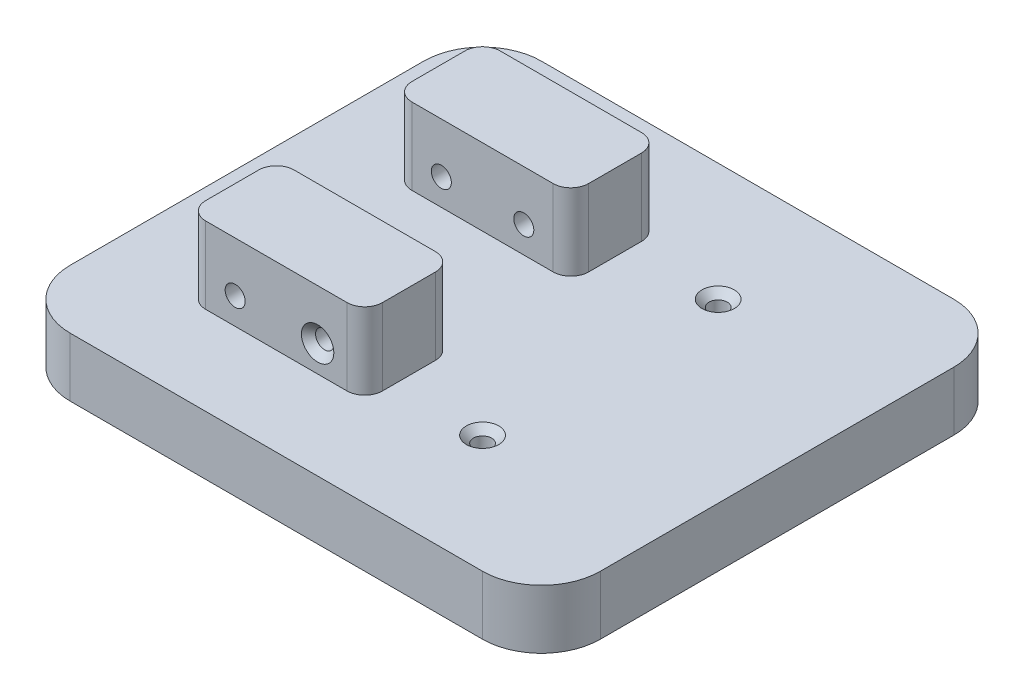
from build123d import *

# Parameters (mm, degrees)
SCHIZZO1_W                               = 90
SCHIZZO1_H                               = 80
ESTRUSIONE_ESTRUSIONE1_DEPTH             = 10
RACCORDO1_R                              = 10
FORO_SVASATO_PER_VITE_M2_5_1_D           = 3.1
FORO_SVASATO_PER_VITE_M2_5_1_CSINK_D     = 5.5
FORO_SVASATO_PER_VITE_M2_5_1_CSINK_ANGLE = 90
SCHIZZO4_W                               = 30
SCHIZZO4_H                               = 15
ESTRUSIONE_ESTRUSIONE2_DEPTH             = 13
FORO_SVASATO_PER_VITE_M2_5_2_D           = 3.1
FORO_SVASATO_PER_VITE_M2_5_2_DEPTH       = 15
FORO_SVASATO_PER_VITE_M2_5_2_CSINK_D     = 5.5
FORO_SVASATO_PER_VITE_M2_5_2_CSINK_ANGLE = 90
FORO_SVASATO_PER_VITE_M2_5_2_TIP         = 0.931333959
RACCORDO2_R                              = 3
SCHIZZO5_R                               = 1.7
TAGLIO_ESTRUSIONE4_DEPTH                 = 15
TAGLIO_ESTRUSIONE5_START                 = -15
SCHIZZO6_R                               = 1.7
TAGLIO_ESTRUSIONE5_DEPTH                 = 15


with BuildPart() as part:
    # Schizzo1 → Estrusione-Estrusione1 (new body)
    with BuildSketch(Plane(origin=(0, 0, 0), x_dir=(1, 0, 0), z_dir=(0, 1, 0))):
        with Locations((-2.6, -4.4)):
            Rectangle(SCHIZZO1_W, SCHIZZO1_H)
    extrude(amount=ESTRUSIONE_ESTRUSIONE1_DEPTH)

    # Raccordo1
    raccordo1_edges = [part.edges().sort_by_distance(p)[0] for p in [
        (-47.6, 5, -35.6),
        (42.4, 5, -35.6),
        (-47.6, 5, 44.4),
        (42.4, 5, 44.4),
    ]]
    fillet(raccordo1_edges, radius=RACCORDO1_R)

    # Foro svasato per Vite M2.5-1 (through all)
    with Locations(Plane(origin=(12.4, 10, -15.6), x_dir=(0, 0, 1), z_dir=(0, 1, 0))):
        with Locations((0, 0), (40, 0)):
            CounterSinkHole(FORO_SVASATO_PER_VITE_M2_5_1_D / 2, FORO_SVASATO_PER_VITE_M2_5_1_CSINK_D / 2, counter_sink_angle=FORO_SVASATO_PER_VITE_M2_5_1_CSINK_ANGLE)

    # Schizzo4 → Estrusione-Estrusione2 (add)
    with BuildSketch(Plane(origin=(0, 10, 0), x_dir=(1, 0, 0), z_dir=(0, 1, 0))):
        with Locations((-17.6, 13.1)):
            Rectangle(SCHIZZO4_W, SCHIZZO4_H)
        with Locations((-17.6, -21.9)):
            Rectangle(SCHIZZO4_W, SCHIZZO4_H)
    extrude(amount=ESTRUSIONE_ESTRUSIONE2_DEPTH)

    # Foro svasato per Vite M2.5-2
    with Locations(Plane(origin=(-10.6, 14.5, 29.4), x_dir=(1, 0, 0), z_dir=(0, 0, 1))):
        with Locations((0, 0)):
            CounterSinkHole(FORO_SVASATO_PER_VITE_M2_5_2_D / 2, FORO_SVASATO_PER_VITE_M2_5_2_CSINK_D / 2, depth=FORO_SVASATO_PER_VITE_M2_5_2_DEPTH, counter_sink_angle=FORO_SVASATO_PER_VITE_M2_5_2_CSINK_ANGLE)
            with Locations((0, 0, -(FORO_SVASATO_PER_VITE_M2_5_2_DEPTH + FORO_SVASATO_PER_VITE_M2_5_2_TIP / 2))):  # 118° drill point
                Cone(0, FORO_SVASATO_PER_VITE_M2_5_2_D / 2, FORO_SVASATO_PER_VITE_M2_5_2_TIP, mode=Mode.SUBTRACT)

    # Raccordo2
    raccordo2_edges = [part.edges().sort_by_distance(p)[0] for p in [
        (-2.6, 16.5, -20.6),
        (-2.6, 16.5, -5.6),
        (-32.6, 16.5, -20.6),
        (-32.6, 16.5, -5.6),
        (-2.6, 16.5, 29.4),
        (-2.6, 16.5, 14.4),
        (-32.6, 16.5, 14.4),
        (-32.6, 16.5, 29.4),
    ]]
    fillet(raccordo2_edges, radius=RACCORDO2_R)

    # Schizzo5 → Taglio-Estrusione4 (cut)
    with BuildSketch(Plane(origin=(0, 0, -20.6), x_dir=(-1, 0, 0), z_dir=(0, 0, -1))):
        with Locations((10.6, 14.5)):
            Circle(SCHIZZO5_R)
        with Locations((24.6, 14.5)):
            Circle(SCHIZZO5_R)
    extrude(amount=-TAGLIO_ESTRUSIONE4_DEPTH, mode=Mode.SUBTRACT)

    # Schizzo6 → Taglio-Estrusione5 (cut)
    with BuildSketch(Plane.XY.offset(29.4).offset(TAGLIO_ESTRUSIONE5_START)):
        with Locations((-24.6, 14.5)):
            Circle(SCHIZZO6_R)
    extrude(amount=TAGLIO_ESTRUSIONE5_DEPTH, mode=Mode.SUBTRACT)


solid = part.part
